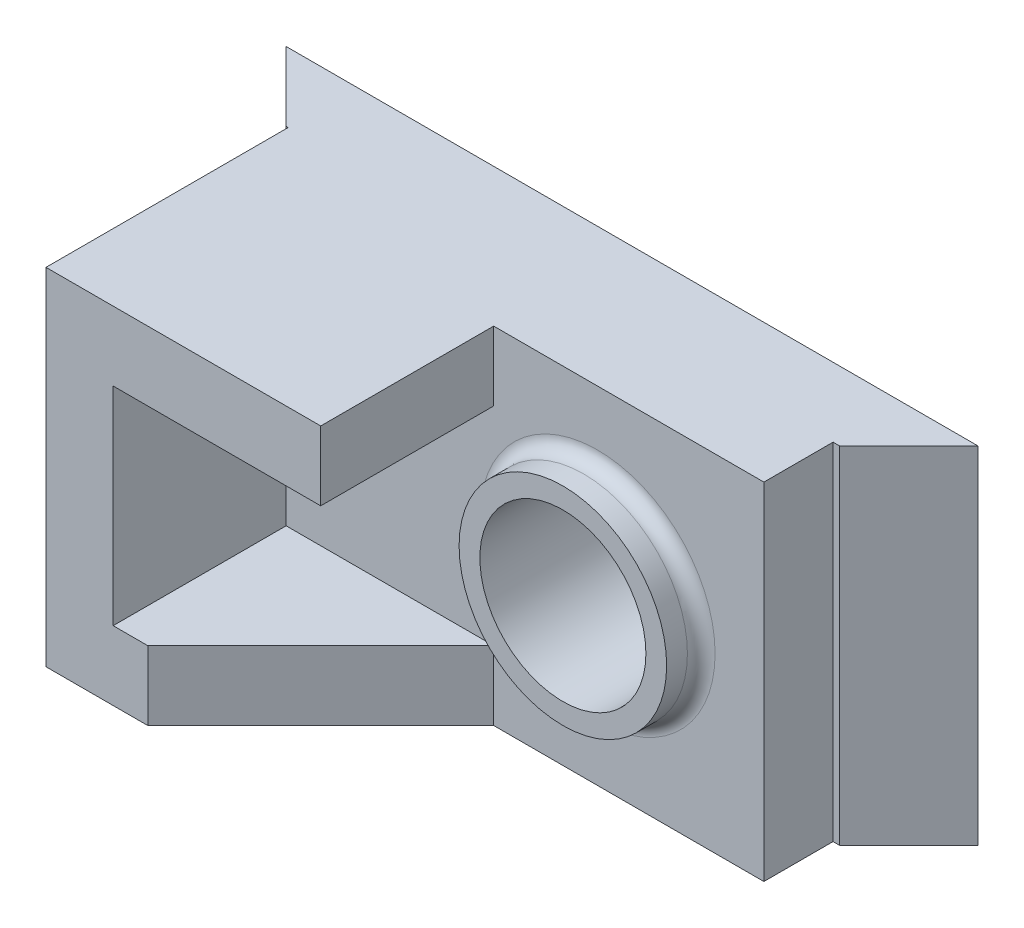
from build123d import *

# Parameters (mm, degrees)
ESQUISSE1_W        = 10.293411782
ESQUISSE1_H        = 50
BOSS_EXTRU_1_DEPTH = 10
ESQUISSE1_5_W      = 30
ESQUISSE1_5_H      = 10
BOSS_EXTRU_2_DEPTH = 45
ESQUISSE1_6_W      = 10.946693759
ESQUISSE1_6_H      = 50
ESQUISSE1_6_W_2    = 10.293411782
BOSS_EXTRU_3_DEPTH = 10
ESQUISSE1_7_R      = 15
ESQUISSE1_7_R_2    = 12
BOSS_EXTRU_4_DEPTH = 25
ESQUISSE1_8_R      = 15
BOSS_EXTRU_5_DEPTH = 20
CONG_3_R           = 2
CHANFREIN2_SIZE    = 25
CHANFREIN21_SIZE   = 10
CHANFREIN22_SIZE   = 10


with BuildPart() as part:
    # Esquisse1 → Boss.-Extru.1 (new body)
    with BuildSketch(Plane.XY):
        with Locations((-44.853294109, 0)):
            Rectangle(ESQUISSE1_W, ESQUISSE1_H)
    extrude(amount=BOSS_EXTRU_1_DEPTH)

    # Esquisse1<5> → Boss.-Extru.2 (add)
    with BuildSketch(Plane.XY):
        Polygon((-30, 25), (-39.706588218, 25), (-39.706588218, -25), (-30, -25), (-30, -15), (-30, 15), align=None)
        with Locations((-15, -20)):
            Rectangle(ESQUISSE1_5_W, ESQUISSE1_5_H)
        with Locations((-15, 20)):
            Rectangle(ESQUISSE1_5_W, ESQUISSE1_5_H)
    extrude(amount=BOSS_EXTRU_2_DEPTH)

    # Esquisse1<6> → Boss.-Extru.3 (add)
    with BuildSketch(Plane.XY):
        with Locations((44.526653121, 0)):
            Rectangle(ESQUISSE1_6_W, ESQUISSE1_6_H)
        with Locations((-44.853294109, 0)):
            Rectangle(ESQUISSE1_6_W_2, ESQUISSE1_6_H)
    extrude(amount=BOSS_EXTRU_3_DEPTH)


with BuildPart() as boss_extru_3_piece_1:
    # of the separate pieces the step leaves, piece 1, a body of its own (boss_extru_3_pieces)
    add(part.part.solids().sort_by_distance((-50, 25, 0))[0])



with BuildPart() as boss_extru_3_piece_2:
    # of the separate pieces the step leaves, piece 2, a body of its own (boss_extru_3_pieces)
    add(part.part.solids().sort_by_distance((39.053306241, -25, 0))[0])


with BuildPart() as body_3:
    # Esquisse1<7> → Boss.-Extru.4 (new body)
    with BuildSketch(Plane.XY):
        with Locations((15, 0)):
            Circle(ESQUISSE1_7_R)
        with Locations((15, 0)):
            Circle(ESQUISSE1_7_R_2, mode=Mode.SUBTRACT)
    extrude(amount=BOSS_EXTRU_4_DEPTH)


with BuildPart() as boss_extru_3_piece_1_1:
    add(boss_extru_3_piece_1.part)

    add(boss_extru_3_piece_2.part)  # Boss.-Extru.5 merges Boss.-Extru.3 piece 2

    add(body_3.part)  # Boss.-Extru.5 merges body 3
    # Esquisse1<8> → Boss.-Extru.5 (add)
    with BuildSketch(Plane.XY):
        Polygon((39.053306241, 25), (0, 25), (0, 15), (-30, 15), (-30, -15), (0, -15), (0, -25), (39.053306241, -25), align=None)
        with Locations((15, 0)):
            Circle(ESQUISSE1_8_R, mode=Mode.SUBTRACT)
    extrude(amount=BOSS_EXTRU_5_DEPTH)

    # Congé3
    cong_3_edges = [boss_extru_3_piece_1_1.edges().sort_by_distance(p)[0] for p in [
        (0, 0, 20),
    ]]
    fillet(cong_3_edges, radius=CONG_3_R)

    # Chanfrein2
    chanfrein2_edges = [boss_extru_3_piece_1_1.edges().sort_by_distance(p)[0] for p in [
        (0, -20, 45),
    ]]
    chamfer(chanfrein2_edges, length=CHANFREIN2_SIZE - 0.0001)  # a hair under: the kernel refuses the full size

    # Chanfrein21
    chanfrein21_edges = [boss_extru_3_piece_1_1.edges().sort_by_distance(p)[0] for p in [
        (50, 0, 10),
    ]]
    chamfer(chanfrein21_edges, length=CHANFREIN21_SIZE - 0.0001)  # a hair under: the kernel refuses the full size

    # Chanfrein22
    chanfrein22_edges = [boss_extru_3_piece_1_1.edges().sort_by_distance(p)[0] for p in [
        (-50, 0, 10),
    ]]
    chamfer(chanfrein22_edges, length=CHANFREIN22_SIZE - 0.0001)  # a hair under: the kernel refuses the full size


solid = boss_extru_3_piece_1_1.part
